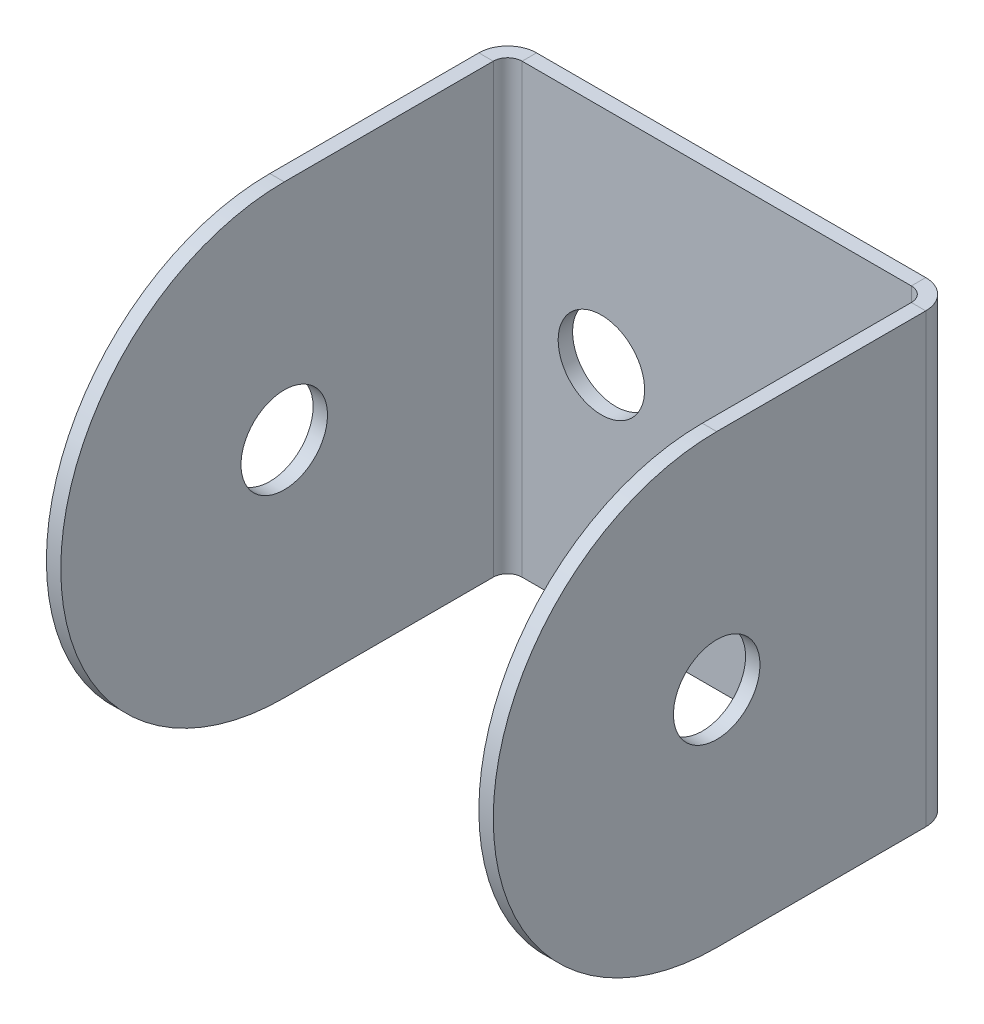
from build123d import *

# Parameters (mm, degrees)
BRIDA_BASE1_DEPTH     = 15.5
CROQUIS5_R            = 1.5
CORTAR_EXTRUIR1_DEPTH = 29.789695
CROQUIS6_R            = 1.5
CORTAR_EXTRUIR2_DEPTH = 0.5


# Sheet-metal steps are written as plain solids
with BuildPart() as part:
    # Croquis1 → Brida base1 (new body)
    with BuildSketch(Plane(origin=(0, 0, 0), x_dir=(1, 0, 0), z_dir=(0, 1, 0))):
        with BuildLine():
            Line((-23.006869712, 2.664043993), (-23.006869712, 17.664043993))
            ThreePointArc((-23.006869712, 17.664043993), (-23.299762931, 18.371150774), (-24.006869712, 18.664043993))
            Line((-24.006869712, 18.664043993), (-37.506869712, 18.664043993))
            ThreePointArc((-37.506869712, 18.664043993), (-38.213976494, 18.371150774), (-38.506869712, 17.664043993))
            Line((-38.506869712, 17.664043993), (-38.506869712, 2.664043993))
            Line((-38.506869712, 2.664043993), (-38.006869712, 2.664043993))
            Line((-38.006869712, 2.664043993), (-38.006869712, 17.664043993))
            ThreePointArc((-38.006869712, 17.664043993), (-37.860423103, 18.017597384), (-37.506869712, 18.164043993))
            Line((-37.506869712, 18.164043993), (-24.006869712, 18.164043993))
            ThreePointArc((-24.006869712, 18.164043993), (-23.653316322, 18.017597384), (-23.506869712, 17.664043993))
            Line((-23.506869712, 17.664043993), (-23.506869712, 2.664043993))
            Line((-23.506869712, 2.664043993), (-23.006869712, 2.664043993))
        make_face()
    extrude(amount=BRIDA_BASE1_DEPTH)

    # Croquis5 → Cortar-Extruir1 (cut, through all)
    with BuildSketch(Plane(origin=(-23.006869712, 0, 0), x_dir=(0, 0, -1), z_dir=(1, 0, 0))):
        with BuildLine():
            ThreePointArc((2.664043993, 7.75), (4.933966439, 13.230077554), (10.414043993, 15.5))
            Line((10.414043993, 15.5), (2.664043993, 15.5))
            Line((2.664043993, 15.5), (2.664043993, 7.75))
        make_face()
        with BuildLine():
            ThreePointArc((10.414043993, 0), (4.933966439, 2.269922446), (2.664043993, 7.75))
            Line((2.664043993, 7.75), (2.664043993, 0))
            Line((2.664043993, 0), (10.414043993, 0))
        make_face()
        with Locations((10.414043993, 7.75)):
            Circle(CROQUIS5_R)
    extrude(amount=-CORTAR_EXTRUIR1_DEPTH, mode=Mode.SUBTRACT)

    # Croquis6 → Cortar-Extruir2 (cut)
    with BuildSketch(Plane.XY.offset(-18.164043993)):
        with Locations((-26.756869712, 7.75)):
            Circle(CROQUIS6_R)
        with Locations(Location((-34.756869712, 7.75, 0), (0, 0, 180))):
            Circle(CROQUIS6_R)
    extrude(amount=-CORTAR_EXTRUIR2_DEPTH, mode=Mode.SUBTRACT)


solid = part.part
